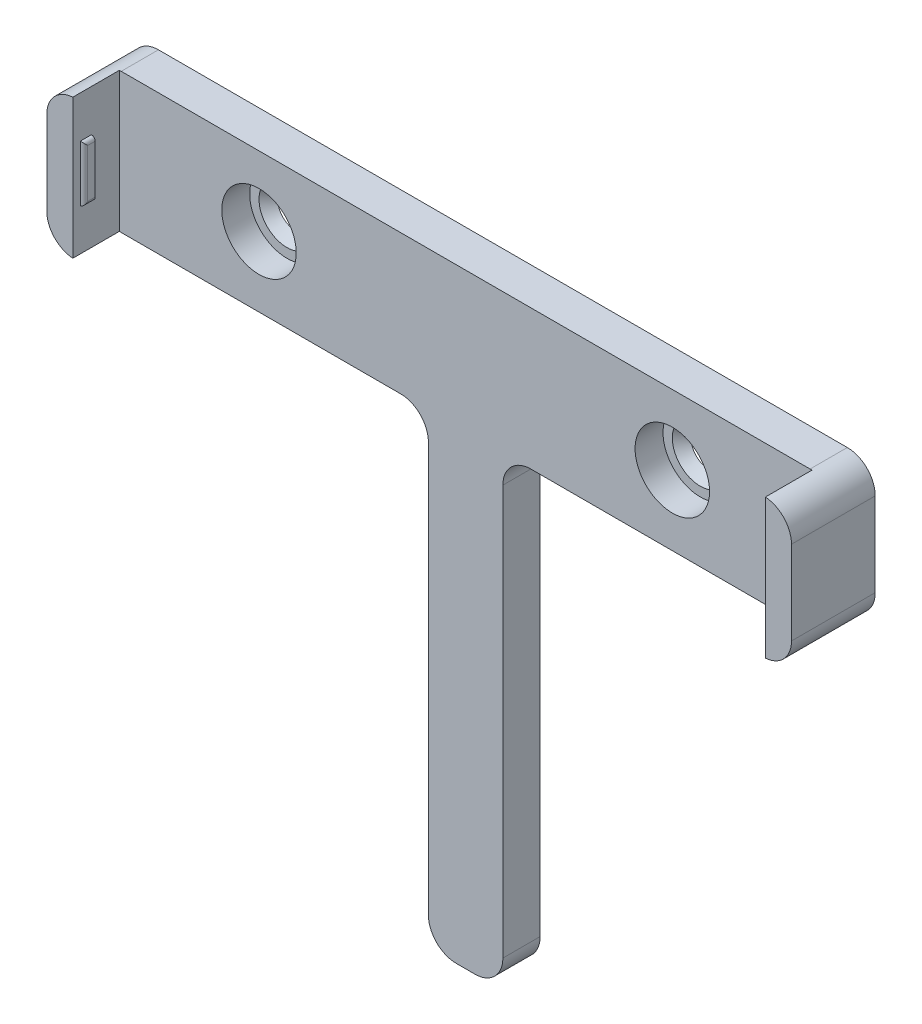
from build123d import *

# Parameters (mm, degrees)
SKETCH1_W           = 80
SKETCH1_H           = 15
BOSS_EXTRUDE1_DEPTH = 4
SKETCH2_W           = 2.8
SKETCH2_H           = 15
BOSS_EXTRUDE2_DEPTH = 5
SKETCH3_W           = 1.2
SKETCH3_H           = 6
BOSS_EXTRUDE3_DEPTH = 0.4
SKETCH4_W           = 1.2
SKETCH4_H           = 6
BOSS_EXTRUDE4_DEPTH = 0.4
FILLET1_R           = 0.4
FILLET2_R           = 3
SKETCH5_W           = 8
SKETCH5_H           = 50
BOSS_EXTRUDE5_DEPTH = 4
FILLET3_R           = 3
SKETCH6_R           = 4
CUT_EXTRUDE1_DEPTH  = 3
SKETCH7_R           = 2
CUT_EXTRUDE2_DEPTH  = 3
CHAMFER1_SIZE       = 1


with BuildPart() as part:
    # Sketch1 → Boss-Extrude1 (new body)
    with BuildSketch(Plane.XY):
        with Locations((40, 7.5)):
            Rectangle(SKETCH1_W, SKETCH1_H)
    extrude(amount=BOSS_EXTRUDE1_DEPTH)

    # Sketch2 → Boss-Extrude2 (add)
    with BuildSketch(Plane.XY.offset(4)):
        with Locations((1.4, 7.5)):
            Rectangle(SKETCH2_W, SKETCH2_H)
        with Locations((78.6, 7.5)):
            Rectangle(SKETCH2_W, SKETCH2_H)
    extrude(amount=BOSS_EXTRUDE2_DEPTH)

    # Sketch3 → Boss-Extrude3 (add)
    with BuildSketch(Plane(origin=(2.8, 0, 0), x_dir=(0, 0, -1), z_dir=(1, 0, 0))):
        with Locations((-7.6, 7.5)):
            Rectangle(SKETCH3_W, SKETCH3_H)
    extrude(amount=BOSS_EXTRUDE3_DEPTH)

    # Sketch4 → Boss-Extrude4 (add)
    with BuildSketch(Plane.ZY.offset(-77.2)):
        with Locations((7.6, 7.5)):
            Rectangle(SKETCH4_W, SKETCH4_H)
    extrude(amount=BOSS_EXTRUDE4_DEPTH)

    # Fillet1
    fillet1_edges = [part.edges().sort_by_distance(p)[0] for p in [
        (3.2, 10.5, 7.6),
        (3.2, 4.5, 7.6),
        (76.8, 10.5, 7.6),
        (76.8, 4.5, 7.6),
        (76.8, 7.5, 8.2),
        (3.2, 7.5, 8.2),
    ]]
    fillet(fillet1_edges, radius=FILLET1_R - 0.0001)  # a hair under: the kernel refuses the full size

    # Fillet2
    fillet2_edges = [part.edges().sort_by_distance(p)[0] for p in [
        (80, 0, 4.5),
        (80, 15, 4.5),
        (0, 0, 4.5),
        (0, 15, 4.5),
    ]]
    fillet(fillet2_edges, radius=FILLET2_R)

    # Sketch5 → Boss-Extrude5 (add)
    with BuildSketch(Plane.XY):
        with Locations((40, -25)):
            Rectangle(SKETCH5_W, SKETCH5_H)
    extrude(amount=BOSS_EXTRUDE5_DEPTH)

    # Fillet3
    fillet3_edges = [part.edges().sort_by_distance(p)[0] for p in [
        (36, 0, 2),
        (36, -50, 2),
        (44, -50, 2),
        (44, 0, 2),
    ]]
    fillet(fillet3_edges, radius=FILLET3_R)

    # Sketch6 → Cut-Extrude1 (cut)
    with BuildSketch(Plane.XY.offset(4)):
        with Locations((17.8, 7.5)):
            Circle(SKETCH6_R)
        with Locations((62.2, 7.5)):
            Circle(SKETCH6_R)
    extrude(amount=-CUT_EXTRUDE1_DEPTH, mode=Mode.SUBTRACT)

    # Sketch7 → Cut-Extrude2 (cut)
    with BuildSketch(Plane.XY.offset(1)):
        with Locations((17.8, 7.5)):
            Circle(SKETCH7_R)
        with Locations((62.2, 7.5)):
            Circle(SKETCH7_R)
    extrude(amount=-CUT_EXTRUDE2_DEPTH, mode=Mode.SUBTRACT)

    # Chamfer1
    chamfer1_edges = [part.edges().sort_by_distance(p)[0] for p in [
        (15.8, 7.5, 1),
        (60.2, 7.5, 1),
    ]]
    chamfer(chamfer1_edges, length=CHAMFER1_SIZE - 0.0001)  # a hair under: the kernel refuses the full size


solid = part.part
